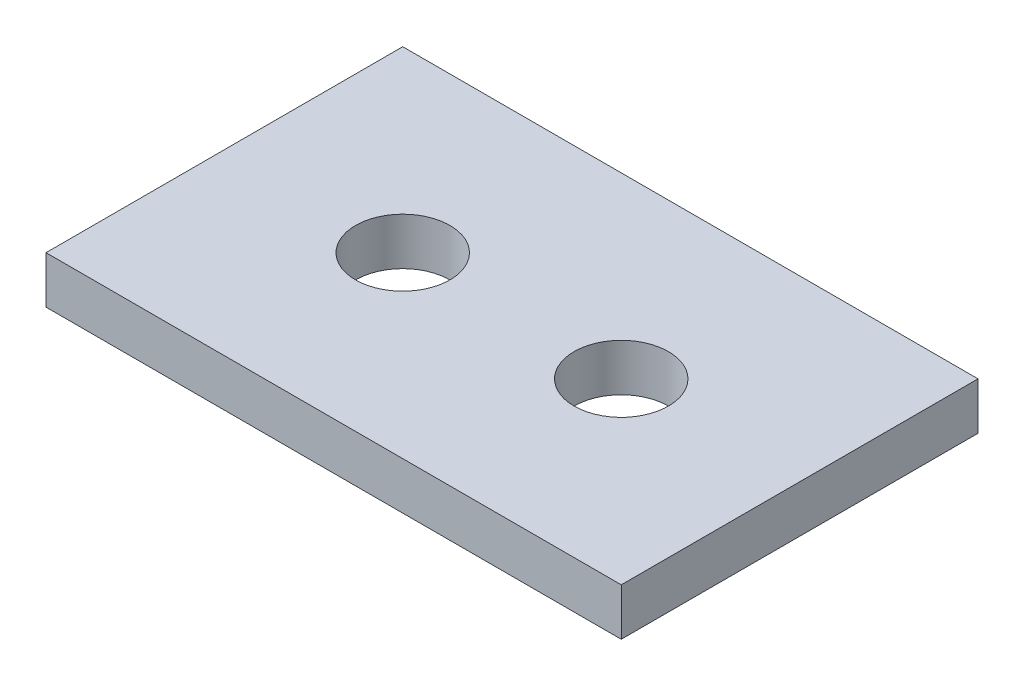
from build123d import *

# Parameters (mm, degrees)
SKETCH1_W           = 19.35
SKETCH1_H           = 12
SKETCH1_R           = 1.5875
BOSS_EXTRUDE1_DEPTH = 0.79375


with BuildPart() as part:
    # Sketch1 → Boss-Extrude1 (new, symmetric)
    with BuildSketch(Plane(origin=(0, 0, 0), x_dir=(1, 0, 0), z_dir=(0, 1, 0))):
        Rectangle(SKETCH1_W, SKETCH1_H)
        with Locations((-3.675, 0)):
            Circle(SKETCH1_R, mode=Mode.SUBTRACT)
        with Locations((3.675, 0)):
            Circle(SKETCH1_R, mode=Mode.SUBTRACT)
    extrude(amount=BOSS_EXTRUDE1_DEPTH, both=True)


solid = part.part
